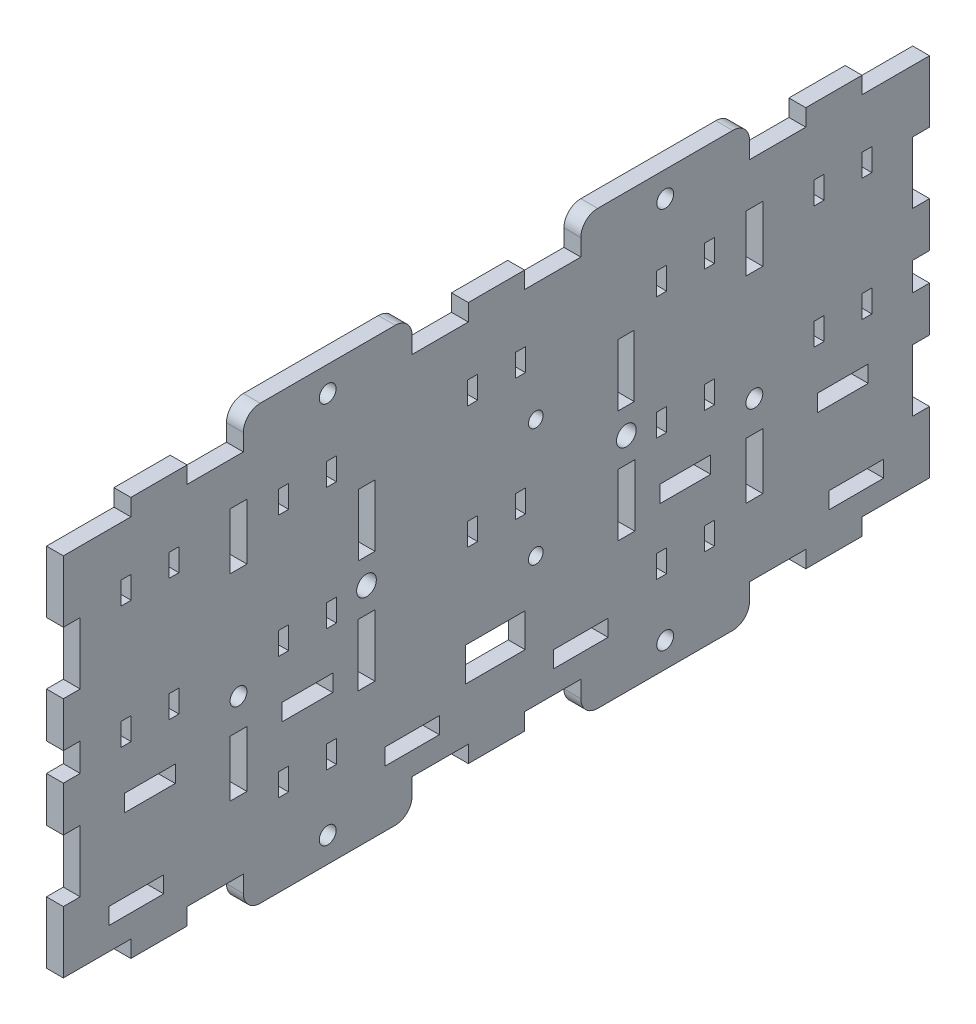
from build123d import *

# Parameters (mm, degrees)
CROQUIS1_W               = 154
CROQUIS1_H               = 71
SALIENTE_EXTRUIR1_DEPTH  = 1.5
CROQUIS2_W               = 12
CROQUIS2_H               = 3
CROQUIS2_W_2             = 10
CROQUIS2_W_3             = 3
CROQUIS2_H_2             = 11
CROQUIS2_H_3             = 5
CORTAR_EXTRUIR1_DEPTH    = 13
CROQUIS4_W               = 30
CROQUIS4_H               = 3
SALIENTE_EXTRUIR3_DEPTH  = 3
REDONDEO2_R              = 3
CROQUIS5_R               = 1.5
CORTAR_EXTRUIR2_DEPTH    = 3
REDONDEO2_OF_SIMETR_A4_R = 3
SIMETR_A5_START          = -1.5
SIMETR_A5_OUTLINE_R      = 1.5
SIMETR_A5_DEPTH          = 3
SIMETR_A5_2_DEPTH        = 3
CROQUIS6_W               = 3
CROQUIS6_H               = 10
CROQUIS6_W_2             = 9.7
CROQUIS6_H_2             = 2.94
CROQUIS6_W_3             = 10.628979849
CROQUIS6_H_3             = 6
CORTAR_EXTRUIR3_DEPTH    = 10
CROQUIS7_R               = 1.5
CORTAR_EXTRUIR4_DEPTH    = 10
CROQUIS8_W               = 9
CROQUIS8_H               = 3
CORTAR_EXTRUIR5_DEPTH    = 10
CROQUIS9_W               = 2.8
CROQUIS9_H               = 14.9
CORTAR_EXTRUIR6_DEPTH    = 10
CROQUIS10_W              = 1.8
CROQUIS10_H              = 4
CORTAR_EXTRUIR7_DEPTH    = 10
CROQUIS11_R              = 1.3
CROQUIS11_R_2            = 1.310434607
CORTAR_EXTRUIR8_DEPTH    = 10
CROQUIS12_W              = 2.9
CROQUIS12_H              = 11
CROQUIS12_W_2            = 3
CORTAR_EXTRUIR9_DEPTH    = 10
CROQUIS13_W              = 3
CROQUIS13_H              = 9
SALIENTE_EXTRUIR4_DEPTH  = 3
CROQUIS14_R              = 1.75
CORTAR_EXTRUIR10_DEPTH   = 3


# Read off the part's stored shape, not the designer's step: Simetría5
with BuildPart() as part:
    # Croquis1 → Saliente-Extruir1 (new, symmetric)
    with BuildSketch(Plane(origin=(0, 0, 0), x_dir=(0, 0, -1), z_dir=(1, 0, 0))):
        Rectangle(CROQUIS1_W, CROQUIS1_H)
    extrude(amount=SALIENTE_EXTRUIR1_DEPTH, both=True)

    # Croquis2 → Cortar-Extruir1 (cut)
    with BuildSketch(Plane(origin=(1.5, 0, 0), x_dir=(0, 0, -1), z_dir=(1, 0, 0))):
        with Locations((-71, 34)):
            Rectangle(CROQUIS2_W, CROQUIS2_H)
        with Locations((-50, 34)):
            Rectangle(CROQUIS2_W_2, CROQUIS2_H)
        with Locations((-10, 34)):
            Rectangle(CROQUIS2_W_2, CROQUIS2_H)
        with Locations((10, 34)):
            Rectangle(CROQUIS2_W_2, CROQUIS2_H)
        with Locations((50, 34)):
            Rectangle(CROQUIS2_W_2, CROQUIS2_H)
        with Locations((71, 34)):
            Rectangle(CROQUIS2_W, CROQUIS2_H)
        with Locations((50, -34)):
            Rectangle(CROQUIS2_W_2, CROQUIS2_H)
        with Locations((10, -34)):
            Rectangle(CROQUIS2_W_2, CROQUIS2_H)
        with Locations((-10, -34)):
            Rectangle(CROQUIS2_W_2, CROQUIS2_H)
        with Locations((-50, -34)):
            Rectangle(CROQUIS2_W_2, CROQUIS2_H)
        with Locations((-71, -34)):
            Rectangle(CROQUIS2_W, CROQUIS2_H)
        with Locations((71, -34)):
            Rectangle(CROQUIS2_W, CROQUIS2_H)
        with Locations((-75.5, -16)):
            Rectangle(CROQUIS2_W_3, CROQUIS2_H_2)
        with Locations((-75.5, 0)):
            Rectangle(CROQUIS2_W_3, CROQUIS2_H_3)
        with Locations((-75.5, 16)):
            Rectangle(CROQUIS2_W_3, CROQUIS2_H_2)
        with Locations((75.5, -16)):
            Rectangle(CROQUIS2_W_3, CROQUIS2_H_2)
        with Locations((75.5, 16)):
            Rectangle(CROQUIS2_W_3, CROQUIS2_H_2)
        with Locations((75.5, 0)):
            Rectangle(CROQUIS2_W_3, CROQUIS2_H_3)
    extrude(amount=-CORTAR_EXTRUIR1_DEPTH, mode=Mode.SUBTRACT)

    # Croquis4 → Saliente-Extruir3 (add)
    with BuildSketch(Plane(origin=(1.5, 0, 0), x_dir=(0, 0, -1), z_dir=(1, 0, 0))):
        with Locations((-30, 37)):
            Rectangle(CROQUIS4_W, CROQUIS4_H)
    saliente_extruir3 = extrude(amount=-SALIENTE_EXTRUIR3_DEPTH)

    # Redondeo2
    redondeo2_edges = [part.edges().sort_by_distance(p)[0] for p in [
        (0, 38.5, 45),
        (0, 38.5, 15),
    ]]
    fillet(redondeo2_edges, radius=REDONDEO2_R)

    # Croquis5 → Cortar-Extruir2 (cut)
    with BuildSketch(Plane(origin=(1.5, 0, 0), x_dir=(0, 0, -1), z_dir=(1, 0, 0))):
        with Locations((-30, 34)):
            Circle(CROQUIS5_R)
    cortar_extruir2 = extrude(amount=-CORTAR_EXTRUIR2_DEPTH, mode=Mode.SUBTRACT)

    # Simetría4: Saliente-Extruir3, Cortar-Extruir2 across plane
    add(saliente_extruir3.mirror(Plane.ZX))
    add(cortar_extruir2.mirror(Plane.ZX), mode=Mode.SUBTRACT)

    # Redondeo2 of Simetría4
    redondeo2_of_simetr_a4_edges = [part.edges().sort_by_distance(p)[0] for p in [
        (0, -38.5, 45),
        (0, -38.5, 15),
    ]]
    fillet(redondeo2_of_simetr_a4_edges, radius=REDONDEO2_OF_SIMETR_A4_R)

    # Simetría5 outline → Simetría5 (cut)
    with BuildSketch(Plane.YZ.offset(SIMETR_A5_START)):
        with Locations((34, -30)):
            Circle(SIMETR_A5_OUTLINE_R)
        with Locations((-34, -30)):
            Circle(SIMETR_A5_OUTLINE_R)
    extrude(amount=SIMETR_A5_DEPTH, mode=Mode.SUBTRACT)

    # Simetr_a5 2 outline → Simetr_a5 2 (add)
    with BuildSketch(Plane.YZ.offset(SIMETR_A5_START)):
        with BuildLine():
            Line((38.5, -42), (38.5, -18))
            ThreePointArc((38.5, -18), (37.621320344, -15.878679656), (35.5, -15))
            Line((35.5, -15), (35.5, -45))
            ThreePointArc((35.5, -45), (37.621320344, -44.121320344), (38.5, -42))
        make_face()
        with BuildLine():
            ThreePointArc((-35.5, -15), (-37.621320344, -15.878679656), (-38.5, -18))
            Line((-38.5, -18), (-38.5, -42))
            ThreePointArc((-38.5, -42), (-37.621320344, -44.121320344), (-35.5, -45))
            Line((-35.5, -45), (-35.5, -15))
        make_face()
    extrude(amount=SIMETR_A5_2_DEPTH)

    # Croquis6 → Cortar-Extruir3 (cut)
    with BuildSketch(Plane.ZY.offset(1.5)):
        with Locations((45.853003866, -15.094545578)):
            Rectangle(CROQUIS6_W, CROQUIS6_H)
        with Locations((45.853003866, 19.905454422)):
            Rectangle(CROQUIS6_W, CROQUIS6_H)
        with Locations((-45.853003866, -15.094545578)):
            Rectangle(CROQUIS6_W, CROQUIS6_H)
        with Locations((-45.853003866, 19.905454422)):
            Rectangle(CROQUIS6_W, CROQUIS6_H)
        with Locations((15, -27)):
            Rectangle(CROQUIS6_W_2, CROQUIS6_H_2)
        with Locations((64, -27)):
            Rectangle(CROQUIS6_W_2, CROQUIS6_H_2)
        with Locations((-64, -27)):
            Rectangle(CROQUIS6_W_2, CROQUIS6_H_2)
        with Locations((-15, -27)):
            Rectangle(CROQUIS6_W_2, CROQUIS6_H_2)
        with Locations((0.209178282, -20)):
            Rectangle(CROQUIS6_W_3, CROQUIS6_H_3)
    extrude(amount=-CORTAR_EXTRUIR3_DEPTH, mode=Mode.SUBTRACT)

    # Croquis7 → Cortar-Extruir4 (cut)
    with BuildSketch(Plane(origin=(1.5, 0, 0), x_dir=(0, 0, -1), z_dir=(1, 0, 0))):
        with Locations((-45.853003866, -4.694545578)):
            Circle(CROQUIS7_R)
        with Locations(Location((45.853003866, -4.694545578, 0), (0, 0, 180))):
            Circle(CROQUIS7_R)
    extrude(amount=-CORTAR_EXTRUIR4_DEPTH, mode=Mode.SUBTRACT)

    # Croquis8 → Cortar-Extruir5 (cut)
    with BuildSketch(Plane.ZY.offset(1.5)):
        with Locations((-33.6, -11)):
            Rectangle(CROQUIS8_W, CROQUIS8_H)
        with Locations((-61.6, -11)):
            Rectangle(CROQUIS8_W, CROQUIS8_H)
        with Locations((33.6, -11)):
            Rectangle(CROQUIS8_W, CROQUIS8_H)
        with Locations((61.6, -11)):
            Rectangle(CROQUIS8_W, CROQUIS8_H)
    extrude(amount=-CORTAR_EXTRUIR5_DEPTH, mode=Mode.SUBTRACT)

    # Croquis9 → Cortar-Extruir6 (cut)
    with BuildSketch(Plane.ZY.offset(1.5)):
        with Locations((-23.1, 1)):
            Rectangle(CROQUIS9_W, CROQUIS9_H)
        with Locations((23.1, 1)):
            Rectangle(CROQUIS9_W, CROQUIS9_H)
    extrude(amount=-CORTAR_EXTRUIR6_DEPTH, mode=Mode.SUBTRACT)

    # Croquis10 → Cortar-Extruir7 (cut)
    with BuildSketch(Plane.ZY.offset(1.5)):
        with Locations((-37.85, -0.125)):
            Rectangle(CROQUIS10_W, CROQUIS10_H)
        with Locations((-29.35, -0.125)):
            Rectangle(CROQUIS10_W, CROQUIS10_H)
        with Locations((-37.85, 21.635)):
            Rectangle(CROQUIS10_W, CROQUIS10_H)
        with Locations((-29.35, 21.635)):
            Rectangle(CROQUIS10_W, CROQUIS10_H)
        with Locations((-37.85, -21.885)):
            Rectangle(CROQUIS10_W, CROQUIS10_H)
        with Locations((-29.35, -21.885)):
            Rectangle(CROQUIS10_W, CROQUIS10_H)
        with Locations((-65.85, 21.635)):
            Rectangle(CROQUIS10_W, CROQUIS10_H)
        with Locations((-57.35, 21.635)):
            Rectangle(CROQUIS10_W, CROQUIS10_H)
        with Locations((-65.85, -0.125)):
            Rectangle(CROQUIS10_W, CROQUIS10_H)
        with Locations((-57.35, -0.125)):
            Rectangle(CROQUIS10_W, CROQUIS10_H)
        with Locations((-4.25, 21.635)):
            Rectangle(CROQUIS10_W, CROQUIS10_H)
        with Locations((4.25, 21.635)):
            Rectangle(CROQUIS10_W, CROQUIS10_H)
        with Locations((-4.25, -0.125)):
            Rectangle(CROQUIS10_W, CROQUIS10_H)
        with Locations((4.25, -0.125)):
            Rectangle(CROQUIS10_W, CROQUIS10_H)
        with Locations((29.35, -21.885)):
            Rectangle(CROQUIS10_W, CROQUIS10_H)
        with Locations((37.85, -21.885)):
            Rectangle(CROQUIS10_W, CROQUIS10_H)
        with Locations((29.35, 21.635)):
            Rectangle(CROQUIS10_W, CROQUIS10_H)
        with Locations((37.85, 21.635)):
            Rectangle(CROQUIS10_W, CROQUIS10_H)
        with Locations((29.35, -0.125)):
            Rectangle(CROQUIS10_W, CROQUIS10_H)
        with Locations((37.85, -0.125)):
            Rectangle(CROQUIS10_W, CROQUIS10_H)
        with Locations((57.35, -0.125)):
            Rectangle(CROQUIS10_W, CROQUIS10_H)
        with Locations((65.85, -0.125)):
            Rectangle(CROQUIS10_W, CROQUIS10_H)
        with Locations((57.35, 21.635)):
            Rectangle(CROQUIS10_W, CROQUIS10_H)
        with Locations((65.85, 21.635)):
            Rectangle(CROQUIS10_W, CROQUIS10_H)
    extrude(amount=-CORTAR_EXTRUIR7_DEPTH, mode=Mode.SUBTRACT)

    # Croquis11 → Cortar-Extruir8 (cut)
    with BuildSketch(Plane(origin=(1.5, 0, 0), x_dir=(0, 0, -1), z_dir=(1, 0, 0))):
        with Locations((-23, 1)):
            Circle(CROQUIS11_R)
        with Locations((7, 11.5)):
            Circle(CROQUIS11_R)
        with Locations((7, -9.5)):
            Circle(CROQUIS11_R_2)
    extrude(amount=-CORTAR_EXTRUIR8_DEPTH, mode=Mode.SUBTRACT)

    # Croquis12 → Cortar-Extruir9 (cut)
    with BuildSketch(Plane(origin=(1.5, 0, 0), x_dir=(0, 0, -1), z_dir=(1, 0, 0))):
        with Locations((-23.05, 11)):
            Rectangle(CROQUIS12_W, CROQUIS12_H)
        with Locations((-23.1, -9)):
            Rectangle(CROQUIS12_W_2, CROQUIS12_H)
    cortar_extruir9 = extrude(amount=-CORTAR_EXTRUIR9_DEPTH, mode=Mode.SUBTRACT)

    # Croquis13 → Saliente-Extruir4 (add)
    with BuildSketch(Plane(origin=(1.5, 0, 0), x_dir=(0, 0, -1), z_dir=(1, 0, 0))):
        with Locations((-23.1, 1)):
            Rectangle(CROQUIS13_W, CROQUIS13_H)
    saliente_extruir4 = extrude(amount=-SALIENTE_EXTRUIR4_DEPTH)

    # Simetría7: Cortar-Extruir9, Saliente-Extruir4 across plane
    add(cortar_extruir9.mirror(Plane.XY), mode=Mode.SUBTRACT)
    add(saliente_extruir4.mirror(Plane.XY))

    # Croquis14 → Cortar-Extruir10 (cut)
    with BuildSketch(Plane.ZY.offset(1.5)):
        with Locations((-23.1, 1)):
            Circle(CROQUIS14_R)
        with Locations((23.1, 1)):
            Circle(CROQUIS14_R)
    extrude(amount=-CORTAR_EXTRUIR10_DEPTH, mode=Mode.SUBTRACT)


solid = part.part
